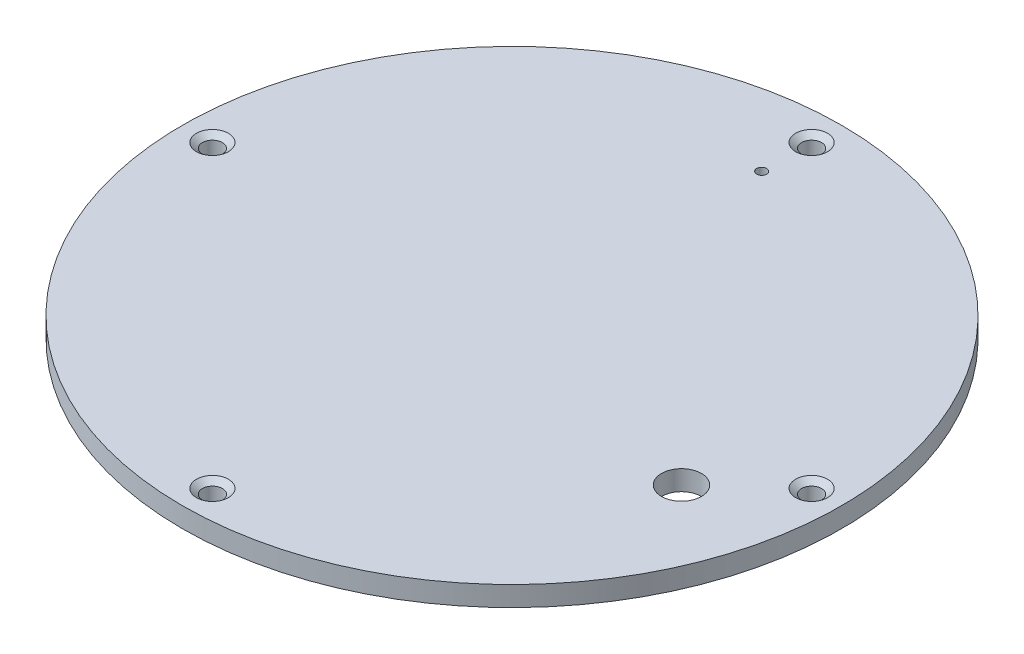
from build123d import *

# Parameters (mm, degrees)
SKETCH1_R                                       = 16.5
BOSS_EXTRUDE1_DEPTH                             = 1
CUT_EXTRUDE1_DEPTH                              = 24.355941428
CUT_EXTRUDE1_DEPTH_BACK                         = 24.355941428
SKETCH6_R                                       = 0.25
SKETCH6_R_2                                     = 1
CSK_FOR_M2_FLAT_HEAD_MACHINE_SCREW1_D           = 1
CSK_FOR_M2_FLAT_HEAD_MACHINE_SCREW1_CSINK_D     = 1.6
CSK_FOR_M2_FLAT_HEAD_MACHINE_SCREW1_CSINK_ANGLE = 100


with BuildPart() as part:
    # Sketch1 → Boss-Extrude1 (new body)
    with BuildSketch(Plane(origin=(0, 0, 0), x_dir=(1, 0, 0), z_dir=(0, 1, 0))):
        Circle(SKETCH1_R)
    extrude(amount=BOSS_EXTRUDE1_DEPTH)

    # Sketch6 → Cut-Extrude1 (cut, two sides: drawn at the far end of the back side and taken through both)
    with BuildSketch(Plane(origin=(0, 1, 0), x_dir=(1, 0, 0), z_dir=(0, 1, 0)).offset(-CUT_EXTRUDE1_DEPTH_BACK)):
        with Locations((0, 12.5)):
            Circle(SKETCH6_R)
        with Locations((11.591109915, -3.105828541)):
            Circle(SKETCH6_R_2)
    extrude(amount=CUT_EXTRUDE1_DEPTH + CUT_EXTRUDE1_DEPTH_BACK, mode=Mode.SUBTRACT)

    # CSK for M2 Flat Head Machine Screw1 (through all)
    with Locations(Plane(origin=(0, 1, 0), x_dir=(1, 0, 0), z_dir=(0, 1, 0))):
        with Locations((0, 15), (-15, 0), (0, -15), (15, 0)):
            CounterSinkHole(CSK_FOR_M2_FLAT_HEAD_MACHINE_SCREW1_D / 2, CSK_FOR_M2_FLAT_HEAD_MACHINE_SCREW1_CSINK_D / 2, counter_sink_angle=CSK_FOR_M2_FLAT_HEAD_MACHINE_SCREW1_CSINK_ANGLE)


solid = part.part
